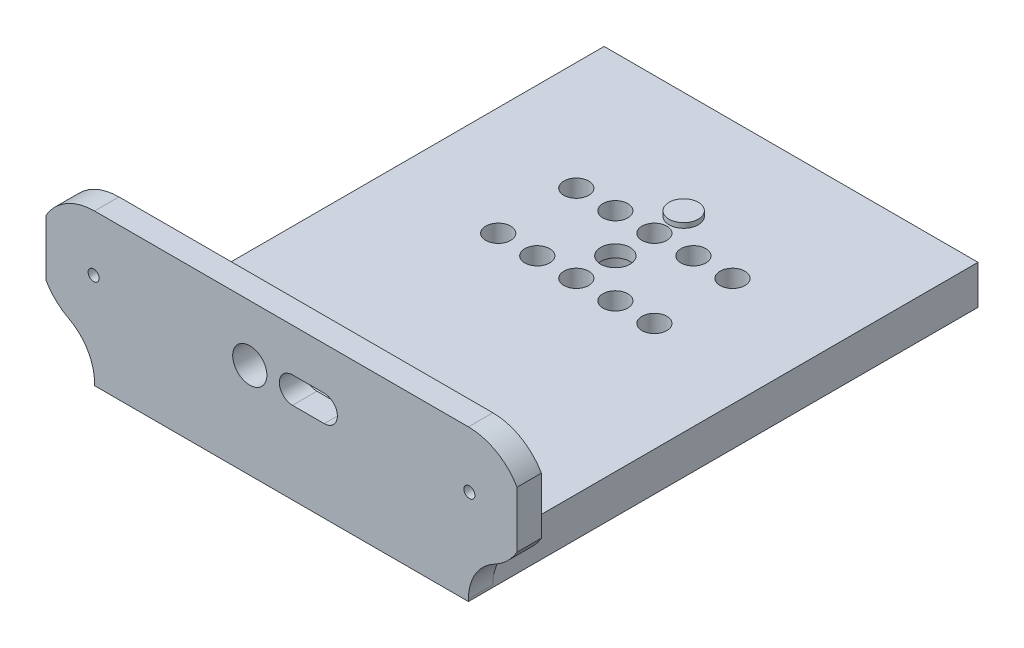
from build123d import *

# Parameters (mm, degrees)
SKETCH_1_W          = 76.6
SKETCH_1_H          = 99.4
SKETCH_1_R          = 3
EXTRUDE_1_DEPTH     = 8
SKETCH_2_R          = 4.5
CUT_EXTRUDE_1_DEPTH = 5.5
SKETCH_3_R          = 3
EXTRUDE_2_DEPTH     = 1
SKETCH_5_R          = 1.05
CUT_EXTRUDE_2_DEPTH = 64.253300309
SKETCH_6_R          = 2.55
CUT_EXTRUDE_3_DEPTH = 5
SKETCH_7_R          = 3.5
SKETCH_7_R_2        = 1.125
EXTRUDE_3_DEPTH     = 5
FILLET_1_R          = 10


with BuildPart() as part:
    # ｽｹｯﾁ1 → ﾎﾞｽ - 押し出し1 (new body)
    with BuildSketch(Plane(origin=(0, 0, 0), x_dir=(1, 0, 0), z_dir=(0, 1, 0))):
        Rectangle(SKETCH_1_W, SKETCH_1_H)
        with Locations((0, 13.7)):
            Circle(SKETCH_1_R, mode=Mode.SUBTRACT)
    extrude(amount=EXTRUDE_1_DEPTH)

    # ｽｹｯﾁ2 → ｶｯﾄ - 押し出し1 (cut)
    with BuildSketch(Plane.XZ):
        with Locations((0, -13.7)):
            Circle(SKETCH_2_R)
    extrude(amount=-CUT_EXTRUDE_1_DEPTH, mode=Mode.SUBTRACT)

    # ｽｹｯﾁ3 → ﾎﾞｽ - 押し出し2 (add)
    with BuildSketch(Plane(origin=(0, 8, 0), x_dir=(1, 0, 0), z_dir=(0, 1, 0))):
        with Locations((0, 27.7)):
            Circle(SKETCH_3_R)
    extrude(amount=EXTRUDE_2_DEPTH)

    # ｽｹｯﾁ5 → ｶｯﾄ - 押し出し2 (cut, through all)
    with BuildSketch(Plane(origin=(0, 8, 0), x_dir=(1, 0, 0), z_dir=(0, 1, 0))):
        with Locations((0, 21.7)):
            Circle(SKETCH_5_R)
        with Locations((8, 21.7)):
            Circle(SKETCH_5_R)
        with Locations((16, 21.7)):
            Circle(SKETCH_5_R)
        with Locations((-8, 21.7)):
            Circle(SKETCH_5_R)
        with Locations((-16, 21.7)):
            Circle(SKETCH_5_R)
        with Locations((-16, 5.7)):
            Circle(SKETCH_5_R)
        with Locations((-8, 5.7)):
            Circle(SKETCH_5_R)
        with Locations((16, 5.7)):
            Circle(SKETCH_5_R)
        with Locations((8, 5.7)):
            Circle(SKETCH_5_R)
        with Locations((0, 5.7)):
            Circle(SKETCH_5_R)
    extrude(amount=-CUT_EXTRUDE_2_DEPTH, mode=Mode.SUBTRACT)

    # ｽｹｯﾁ6 → ｶｯﾄ - 押し出し3 (cut)
    with BuildSketch(Plane(origin=(0, 8, 0), x_dir=(1, 0, 0), z_dir=(0, 1, 0))):
        with Locations((-8, 21.7)):
            Circle(SKETCH_6_R)
        with Locations((-16, 21.7)):
            Circle(SKETCH_6_R)
        with Locations((0, 21.7)):
            Circle(SKETCH_6_R)
        with Locations((8, 21.7)):
            Circle(SKETCH_6_R)
        with Locations((16, 21.7)):
            Circle(SKETCH_6_R)
        with Locations((-8, 5.7)):
            Circle(SKETCH_6_R)
        with Locations((0, 5.7)):
            Circle(SKETCH_6_R)
        with Locations((8, 5.7)):
            Circle(SKETCH_6_R)
        with Locations((16, 5.7)):
            Circle(SKETCH_6_R)
        with Locations((-16, 5.7)):
            Circle(SKETCH_6_R)
    extrude(amount=-CUT_EXTRUDE_3_DEPTH, mode=Mode.SUBTRACT)

    # ｽｹｯﾁ7 → ﾎﾞｽ - 押し出し3 (add)
    with BuildSketch(Plane.XY.offset(49.7)):
        with BuildLine():
            Line((-38.3, 0), (38.3, 0))
            Line((38.3, 0), (38.3, 8))
            ThreePointArc((38.3, 8), (44.041962124, 9.536071509), (48.25, 13.733935484))
            Line((48.25, 13.733935484), (48.25, 25.266064516))
            ThreePointArc((48.25, 25.266064516), (44.041962124, 29.463928491), (38.3, 31))
            Line((38.3, 31), (-38.3, 31))
            ThreePointArc((-38.3, 31), (-44.041962124, 29.463928491), (-48.25, 25.266064516))
            Line((-48.25, 25.266064516), (-48.25, 13.733935484))
            ThreePointArc((-48.25, 13.733935484), (-44.041962124, 9.536071509), (-38.3, 8))
            Line((-38.3, 8), (-38.3, 0))
        make_face()
        with Locations((-6.5, 19.5)):
            Circle(SKETCH_7_R, mode=Mode.SUBTRACT)
        with Locations((38.5, 19.5)):
            Circle(SKETCH_7_R_2, mode=Mode.SUBTRACT)
        with Locations((-38.5, 19.5)):
            Circle(SKETCH_7_R_2, mode=Mode.SUBTRACT)
        with BuildLine():
            Line((2.25, 16.8), (8.75, 16.8))
            ThreePointArc((8.75, 16.8), (11.45, 19.5), (8.75, 22.2))
            Line((8.75, 22.2), (2.25, 22.2))
            ThreePointArc((2.25, 22.2), (-0.45, 19.5), (2.25, 16.8))
        make_face(mode=Mode.SUBTRACT)
    extrude(amount=EXTRUDE_3_DEPTH)

    # ﾌｨﾚｯﾄ1
    fillet_1_edges = [part.edges().sort_by_distance(p)[0] for p in [
        (38.3, 8, 52.2),
        (-38.3, 8, 52.2),
    ]]
    fillet(fillet_1_edges, radius=FILLET_1_R)


solid = part.part
